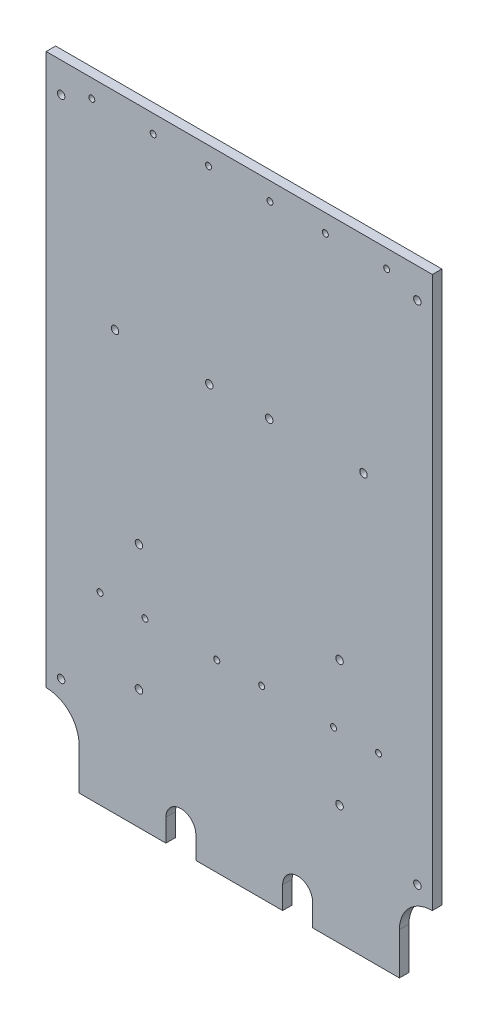
from build123d import *

# Parameters (mm, degrees)
SKETCH1_W           = 129
SKETCH1_H           = 209
BOSS_EXTRUDE1_DEPTH = 3.175
SKETCH2_R           = 1.25
SKETCH2_W           = 11
SKETCH2_H           = 25
CUT_EXTRUDE1_DEPTH  = 123.843724402
FILLET1_R           = 11
SKETCH3_R           = 1
CUT_EXTRUDE2_DEPTH  = 123.843724402
LPATTERN1_COUNT     = 2
LPATTERN1_PITCH     = 39
LPATTERN1_COL_COUNT = 2
LPATTERN1_COL_PITCH = 39
CUT_EXTRUDE3_DEPTH  = 123.843724402
SKETCH5_R           = 1.25
CUT_EXTRUDE4_DEPTH  = 123.843724402
SKETCH6_R           = 1.25
CUT_EXTRUDE5_DEPTH  = 123.843724402


with BuildPart() as part:
    # Sketch1 → Boss-Extrude1 (new body)
    with BuildSketch(Plane.XY):
        Rectangle(SKETCH1_W, SKETCH1_H)
    extrude(amount=BOSS_EXTRUDE1_DEPTH)

    # Sketch2 → Cut-Extrude1 (cut, through all)
    with BuildSketch(Plane.XY.offset(3.175)):
        with Locations((-59.5, 94.5)):
            Circle(SKETCH2_R)
        with Locations((-59.5, -74.5)):
            Circle(SKETCH2_R)
        with Locations(Location((59.5, -74.5, 0), (0, 0, 180))):
            Circle(SKETCH2_R)
        with Locations(Location((59.5, 94.5, 0), (0, 0, 180))):
            Circle(SKETCH2_R)
        with Locations((-59, -92)):
            Rectangle(SKETCH2_W, SKETCH2_H)
        with Locations((59, -92)):
            Rectangle(SKETCH2_W, SKETCH2_H)
    extrude(amount=-CUT_EXTRUDE1_DEPTH, mode=Mode.SUBTRACT)

    # Fillet1
    fillet1_edges = [part.edges().sort_by_distance(p)[0] for p in [
        (53.5, -79.5, 1.5875),
        (-53.5, -79.5, 1.5875),
    ]]
    fillet(fillet1_edges, radius=FILLET1_R - 0.0001)  # a hair under: the kernel refuses the full size

    # Sketch3 → Cut-Extrude2 (cut, through all)
    with BuildSketch(Plane.XY.offset(3.175)):
        with Locations((-10.25, 98.5)):
            Circle(SKETCH3_R)
        with Locations((10.25, 98.5)):
            Circle(SKETCH3_R)
        with Locations((-7.5, -43)):
            Circle(SKETCH3_R)
        with Locations((7.5, -43)):
            Circle(SKETCH3_R)
    cut_extrude2 = extrude(amount=-CUT_EXTRUDE2_DEPTH, mode=Mode.SUBTRACT)

    # LPattern1: Cut-Extrude2 ×2
    with Locations(*[(i * LPATTERN1_PITCH, 0, 0) for i in range(1, LPATTERN1_COUNT)]):
        add(cut_extrude2, mode=Mode.SUBTRACT)

    # LPattern1 col: Cut-Extrude2 ×2
    with Locations(*[(-i * LPATTERN1_COL_PITCH, 0, 0) for i in range(1, LPATTERN1_COL_COUNT)]):
        add(cut_extrude2, mode=Mode.SUBTRACT)

    # Sketch4 → Cut-Extrude3 (cut, through all)
    with BuildSketch(Plane.XY.offset(3.175)):
        with BuildLine():
            Line((-24.5, -104.5), (-24.5, -97))
            ThreePointArc((-24.5, -97), (-19.5, -92), (-14.5, -97))
            Line((-14.5, -97), (-14.5, -104.5))
            ThreePointArc((-14.5, -104.5), (-19.5, -109.5), (-24.5, -104.5))
        make_face()
        with BuildLine():
            Line((14.5, -104.5), (14.5, -97))
            ThreePointArc((14.5, -97), (19.5, -92), (24.5, -97))
            Line((24.5, -97), (24.5, -104.5))
            ThreePointArc((24.5, -104.5), (19.5, -109.5), (14.5, -104.5))
        make_face()
    extrude(amount=-CUT_EXTRUDE3_DEPTH, mode=Mode.SUBTRACT)

    # Sketch5 → Cut-Extrude4 (cut, through all)
    with BuildSketch(Plane.XY.offset(3.175)):
        with Locations((-10, 35.5)):
            Circle(SKETCH5_R)
        with Locations((-41.5, 35.5)):
            Circle(SKETCH5_R)
        with Locations((10, 35.5)):
            Circle(SKETCH5_R)
        with Locations((41.5, 35.5)):
            Circle(SKETCH5_R)
    extrude(amount=-CUT_EXTRUDE4_DEPTH, mode=Mode.SUBTRACT)

    # Sketch6 → Cut-Extrude5 (cut, through all)
    with BuildSketch(Plane(origin=(0, 0, 0), x_dir=(-1, 0, 0), z_dir=(0, 0, -1))):
        with Locations((-33.5, -22.5)):
            Circle(SKETCH6_R)
        with Locations((33.5, -22.5)):
            Circle(SKETCH6_R)
        with Locations((33.5, -64.5)):
            Circle(SKETCH6_R)
        with Locations((-33.5, -64.5)):
            Circle(SKETCH6_R)
    extrude(amount=-CUT_EXTRUDE5_DEPTH, mode=Mode.SUBTRACT)


solid = part.part
